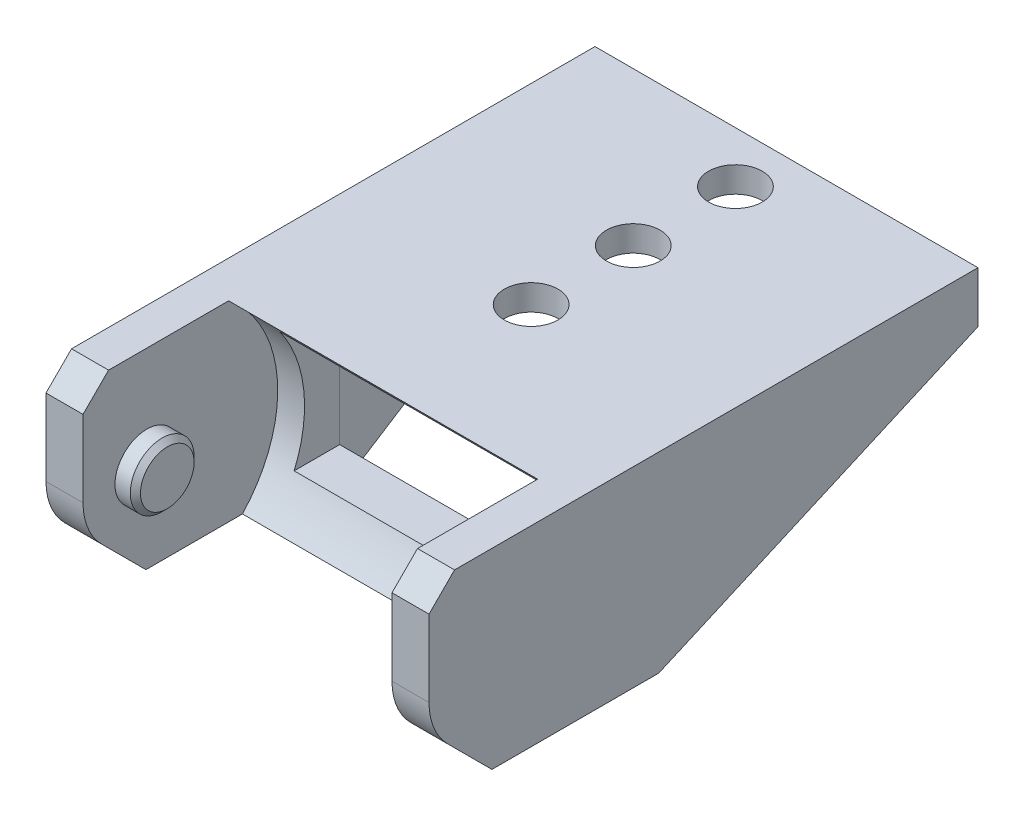
from build123d import *

# Parameters (mm, degrees)
SKETCH_1_W               = 30
SKETCH_1_H               = 15
EXTRUDE_1_DEPTH          = 18
CUT_EXTRUDE_1_REACH      = 28.843
SKETCH_2_W               = 20
SKETCH_2_H               = 10
CUT_EXTRUDE_2_REACH      = 29.668
SKETCH_3_W               = 20
SKETCH_3_H               = 12
CUT_EXTRUDE_5_DEPTH      = 22.1
CUT_EXTRUDE_5_DEPTH_BACK = 2.1
SKETCH_4_W               = 5
SKETCH_4_H               = 6
SKETCH_5_R               = 2.5
EXTRUDE_2_DEPTH          = 1.6
EXTRUDE_START            = 1.6
SKETCH_6_R               = 2.5
EXTRUDE_3_DEPTH          = 1.6
CHAMFER_1_SIZE           = 0.4
CUT_EXTRUDE_6_DEPTH      = 35.020684023
CUT_EXTRUDE_6_DEPTH_BACK = 35.020684023
CUT_EXTRUDE_7_DEPTH      = 35.020684023
CUT_EXTRUDE_7_DEPTH_BACK = 35.020684023
CHAMFER_2_SIZE           = 2
EXTRUDE_4_DEPTH          = 25
CHAMFER_3_SIZE           = 25
CHAMFER_3_SIZE2          = 11
SKETCH_10_R              = 2.1
CUT_EXTRUDE_8_DEPTH      = 15
CHAMFER_4_SIZE           = 3
CHAMFER_4_SIZE_2         = 25


with BuildPart() as part:
    # 草圖1 → 填料-伸長1 (new body)
    with BuildSketch(Plane.XY):
        with Locations((2.249045701, -2.44972067)):
            Rectangle(SKETCH_1_W, SKETCH_1_H)
    extrude(amount=EXTRUDE_1_DEPTH)

    # 草圖2 → 除料-伸長1 (cut, up to next)
    with BuildSketch(Plane.XY.offset(18), mode=Mode.PRIVATE) as cut_extrude_1_sk1:
        with Locations((2.249045701, -1.94972067)):
            Rectangle(SKETCH_2_W, SKETCH_2_H)
    cut_extrude_1_tool1 = extrude(cut_extrude_1_sk1.sketch, amount=-CUT_EXTRUDE_1_REACH, mode=Mode.PRIVATE) & part.part
    add(cut_extrude_1_tool1.solids().sort_by_distance((2.249046, -1.949721, 18))[0], mode=Mode.SUBTRACT)

    # 草圖3 → 除料-伸長2 (cut, up to next)
    with BuildSketch(Plane(origin=(0, -6.94972067, 0), x_dir=(1, 0, 0), z_dir=(0, 1, 0)), mode=Mode.PRIVATE) as cut_extrude_2_sk1:
        with Locations((2.249045701, -12)):
            Rectangle(SKETCH_3_W, SKETCH_3_H)
    cut_extrude_2_tool1 = extrude(cut_extrude_2_sk1.sketch, amount=-CUT_EXTRUDE_2_REACH, mode=Mode.PRIVATE) & part.part
    add(cut_extrude_2_tool1.solids().sort_by_distance((2.249046, -6.949721, 12))[0], mode=Mode.SUBTRACT)

    # 草圖4 → 除料-伸長5 (cut, two sides: drawn at the far end of the back side and taken through both)
    with BuildSketch(Plane(origin=(-7.750954299, 0, 0), x_dir=(0, 0, -1), z_dir=(1, 0, 0)).offset(-CUT_EXTRUDE_5_DEPTH_BACK)):
        with Locations((-15.5, 0.05027933)):
            Rectangle(SKETCH_4_W, SKETCH_4_H)
        with BuildLine():
            Line((-13, 3.05027933), (-13, -2.94972067))
            Line((-13, -2.94972067), (-18, -2.94972067))
            Line((-18, -2.94972067), (-18, -9.94972067))
            Line((-18, -9.94972067), (-6, -9.94972067))
            Line((-6, -9.94972067), (-6, -6.94972067))
            Line((-6, -6.94972067), (-3.562706956, -6.94972067))
            ThreePointArc((-3.562706956, -6.94972067), (-2.955231369, -4.990584005), (-2.75, -2.94972067))
            ThreePointArc((-2.75, -2.94972067), (-3.246950555, 0.203139384), (-4.689614931, 3.05027933))
            Line((-4.689614931, 3.05027933), (-13, 3.05027933))
        make_face()
        with BuildLine():
            ThreePointArc((-18, 5.998044414), (-15.583399687, 6.969379392), (-13, 7.30027933))
            Line((-13, 7.30027933), (-13, 7.89449882))
            Line((-13, 7.89449882), (-18, 7.89449882))
            Line((-18, 7.89449882), (-18, 5.998044414))
        make_face()
        with BuildLine():
            Line((-13, 7.30027933), (-13, 3.05027933))
            Line((-13, 3.05027933), (-4.689614931, 3.05027933))
            ThreePointArc((-4.689614931, 3.05027933), (-8.332961324, 6.176135454), (-13, 7.30027933))
        make_face()
        with BuildLine():
            Line((-18, 3.05027933), (-13, 3.05027933))
            Line((-13, 3.05027933), (-13, 7.30027933))
            ThreePointArc((-13, 7.30027933), (-15.583399687, 6.969379392), (-18, 5.998044414))
            Line((-18, 5.998044414), (-18, 3.05027933))
        make_face()
        with BuildLine():
            Line((-18, -9.94972067), (-18, -2.94972067))
            Line((-18, -2.94972067), (-18, 3.05027933))
            Line((-18, 3.05027933), (-18, 5.998044414))
            ThreePointArc((-18, 5.998044414), (-19.843504041, -10.580510436), (-3.562706956, -6.94972067))
            Line((-3.562706956, -6.94972067), (-6, -6.94972067))
            Line((-6, -6.94972067), (-6, -9.94972067))
            Line((-6, -9.94972067), (-18, -9.94972067))
        make_face()
    extrude(amount=CUT_EXTRUDE_5_DEPTH + CUT_EXTRUDE_5_DEPTH_BACK, mode=Mode.SUBTRACT)

    # 草圖5 → 填料-伸長2 (add)
    with BuildSketch(Plane.ZY.offset(-14.349045701)):
        with Locations(Location((13, -2.94972067, 0), (0, 0, 90))):
            Circle(SKETCH_5_R)
    extrude(amount=EXTRUDE_2_DEPTH)

    # 草圖6 → 填料-伸長3 (add)
    with BuildSketch(Plane(origin=(-9.850954299, 0, 0), x_dir=(0, 0, -1), z_dir=(1, 0, 0)).offset(EXTRUDE_START)):
        with Locations(Location((-13, -2.94972067, 0), (0, 0, 90))):
            Circle(SKETCH_6_R)
    extrude(amount=-EXTRUDE_3_DEPTH)

    # 導角1
    chamfer_1_edges = [part.edges().sort_by_distance(p)[0] for p in [
        (12.749045701, -5.44972067, 13),
        (-8.250954299, -5.44972067, 13),
    ]]
    chamfer(chamfer_1_edges, length=CHAMFER_1_SIZE)

    # 草圖7 → 除料-伸長6 (cut, two sides: drawn at the far end of the back side and taken through both)
    with BuildSketch(Plane(origin=(-9.850954299, 0, 0), x_dir=(0, 0, -1), z_dir=(1, 0, 0)).offset(-CUT_EXTRUDE_6_DEPTH_BACK)):
        Polygon((-18, -9.94972067), (-13.071067812, -9.94972067), (-18, -5.020788482), align=None)
    extrude(amount=CUT_EXTRUDE_6_DEPTH + CUT_EXTRUDE_6_DEPTH_BACK, mode=Mode.SUBTRACT)

    # 草圖8 → 除料-伸長7 (cut, two sides: drawn at the far end of the back side and taken through both)
    with BuildSketch(Plane(origin=(-9.850954299, 0, 0), x_dir=(0, 0, -1), z_dir=(1, 0, 0)).offset(-CUT_EXTRUDE_7_DEPTH_BACK)):
        with BuildLine():
            Line((-18, -2.94972067), (-18, -5.020788482))
            Line((-18, -5.020788482), (-16.535533871, -6.485254612))
            ThreePointArc((-16.535533871, -6.485254612), (-17.619397653, -4.863137855), (-18, -2.94972067))
        make_face()
    extrude(amount=CUT_EXTRUDE_7_DEPTH + CUT_EXTRUDE_7_DEPTH_BACK, mode=Mode.SUBTRACT)

    # 導角2
    chamfer_2_edges = [part.edges().sort_by_distance(p)[0] for p in [
        (15.799045701, 5.05027933, 18),
        (-11.300954299, 5.05027933, 18),
    ]]
    chamfer(chamfer_2_edges, length=CHAMFER_2_SIZE)

    # 草圖9 → 填料-伸長4 (add)
    with BuildSketch(Plane(origin=(0, 0, 0), x_dir=(-1, 0, 0), z_dir=(0, 0, -1))):
        Polygon((-12.249045701, 3.05027933), (-12.249045701, -9.94972067), (-17.249045701, -9.94972067), (-17.249045701, 5.05027933), (12.750954299, 5.05027933), (12.750954299, -9.94972067), (7.750954299, -9.94972067), (7.750954299, 3.05027933), align=None)
    extrude(amount=EXTRUDE_4_DEPTH)

    # 導角3
    chamfer_3_edges = [part.edges().sort_by_distance(p)[0] for p in [
        (-10.250954299, -9.94972067, -25),
        (14.749045701, -9.94972067, -25),
    ]]
    chamfer_3_side = [part.faces().sort_by_distance(p)[0] for p in [
        (2.249045701, -9.94972067, 0.484706737),
    ]]
    chamfer(chamfer_3_edges, length=CHAMFER_3_SIZE, length2=CHAMFER_3_SIZE2, reference=chamfer_3_side[0])

    # 草圖10 → 除料-伸長8 (cut)
    with BuildSketch(Plane.XZ.offset(-3.05027933)):
        with Locations(Location((2.249045701, -21, 0), (0, 0, 270))):
            Circle(SKETCH_10_R)
        with Locations(Location((2.249045701, -13, 0), (0, 0, 270))):
            Circle(SKETCH_10_R)
        with Locations(Location((2.249045701, -5, 0), (0, 0, 270))):
            Circle(SKETCH_10_R)
    extrude(amount=-CUT_EXTRUDE_8_DEPTH, mode=Mode.SUBTRACT)

    # 導角4
    # the kernel refuses this chamfer: 25, 3 mm, written as the material it takes off along each edge
    with BuildSketch(Plane(origin=(-7.750954299, -63.93259543, -25), x_dir=(-0.952888564534268, 0, -0.3033205953769419), z_dir=(0, 1, 0)), Plane(origin=(12.249045701, 3.05027933, -25), x_dir=(0.952888564534268, 0, -0.3033205953769419), z_dir=(0, -1, 0))) as chamfer_4_piece_1:
        Polygon((CHAMFER_4_SIZE * 0.952888564534, CHAMFER_4_SIZE * 0.303320595377), (-CHAMFER_4_SIZE_2 * 0.303320595377, CHAMFER_4_SIZE_2 * 0.952888564534), (0, 0), align=None)
    extrude(amount=66.98287476, mode=Mode.SUBTRACT)


solid = part.part
